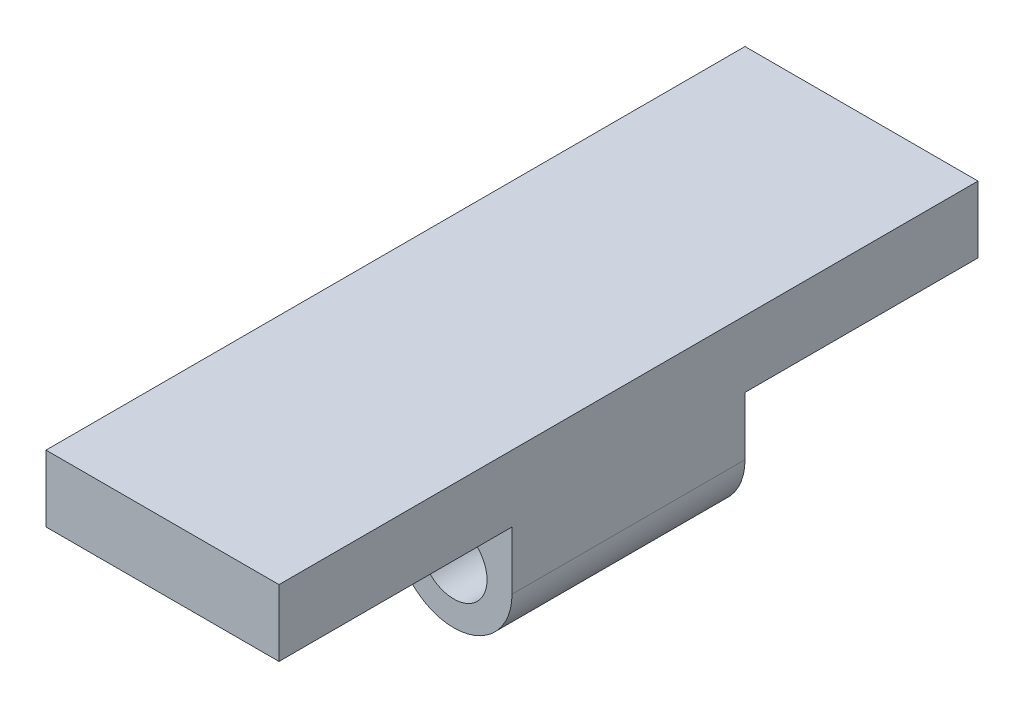
from build123d import *

# Parameters (mm, degrees)
SKETCH1_W           = 7
SKETCH1_H           = 2
BOSS_EXTRUDE1_DEPTH = 10.5
SKETCH2_R           = 1
BOSS_EXTRUDE2_DEPTH = 3.5
SKETCH3_R           = 0.975
BOSS_EXTRUDE3_DEPTH = 4.5
SWEEP1_ANGLE        = 52.758136
SWEEP1_2_OUTLINE_R  = 0.975
SWEEP1_2_ANGLE      = 51.827212
SWEEP1_START        = -1.300671735
SWEEP1_3_OUTLINE_R  = 0.975
SWEEP1_3_DEPTH      = 6.012679668
SWEEP1_4_OUTLINE_R  = 0.975
SWEEP1_4_DEPTH      = 4.014132691


with BuildPart() as part:
    # Sketch1 → Boss-Extrude1 (new, symmetric)
    with BuildSketch(Plane.XY):
        with Locations((-0.090659996, 1.000603453)):
            Rectangle(SKETCH1_W, SKETCH1_H)
    extrude(amount=BOSS_EXTRUDE1_DEPTH, both=True)

    # Sketch2 → Boss-Extrude2 (add, symmetric)
    with BuildSketch(Plane.XY):
        with BuildLine():
            Line((3.409340004, 0.000603453), (3.409340004, -1.749396547))
            ThreePointArc((3.409340004, -1.749396547), (1.659340004, -3.499396547), (-0.090659996, -1.749396547))
            Line((-0.090659996, -1.749396547), (-0.090659996, 0.000603453))
            Line((-0.090659996, 0.000603453), (3.409340004, 0.000603453))
        make_face()
        with Locations((1.659340004, -1.749396547)):
            Circle(SKETCH2_R, mode=Mode.SUBTRACT)
    extrude(amount=BOSS_EXTRUDE2_DEPTH, both=True)

    # Sweep1: read off the stored shape, not the designer's step
    # Sweep1 outline → Sweep1 (revolve)
    with BuildSketch(Plane(origin=(3.593677223, 0.783196597, 2.967256422), x_dir=(0.7080400901637386, -0.39610400747133684, 0.5846202579333633), z_dir=(0.3054408532938203, 0.9182056497676037, 0.2521988696921456))):
        with BuildLine():
            Line((0.806226014, -6.042187467), (0.806225946, -7.953288333))
            ThreePointArc((0.806225946, -7.953288333), (1.975, -6.997737942), (0.806226014, -6.042187467))
        make_face()
    sweep1 = revolve(axis=Axis((3.593677223, 0.783196597, 2.967256422), (0.6366986067678082, 0, -0.7711127570854551)), revolution_arc=SWEEP1_ANGLE)

    # Sweep1 2 outline → Sweep1 2 (revolve)
    with BuildSketch(Plane(origin=(-4.579891067, -1.470607223, 4.014132591), x_dir=(-0.5884431979545631, -0.18894965071935535, 0.7861505150249796), z_dir=(0.7485091599062733, 0.24034697795155588, 0.6180350861609393))):
        with Locations((1, -0.028291715)):
            Circle(SWEEP1_2_OUTLINE_R)
    sweep1_2 = revolve(axis=Axis((-4.579891067, -1.470607223, 4.014132591), (0.3057264141637292, -0.9521194041098986, 0)), revolution_arc=SWEEP1_2_ANGLE)

    # Sweep1 3 outline → Sweep1 3 (add)
    with BuildSketch(Plane(origin=(0, 0, 0), x_dir=(0.6631244510169609, -0.2712943464482258, -0.69761403372401), z_dir=(0.7485091599061792, 0.24034697795152507, 0.6180350861610652)).offset(SWEEP1_START)):
        with Locations((-6.338808877, -3.261453929)):
            Circle(SWEEP1_3_OUTLINE_R)
    sweep1_3 = extrude(amount=SWEEP1_3_DEPTH)

    # Sweep1 4 outline → Sweep1 4 (add)
    with BuildSketch(Plane.XY):
        with Locations((-5.540659996, -1.749396547)):
            Circle(SWEEP1_4_OUTLINE_R)
    sweep1_4 = extrude(amount=SWEEP1_4_DEPTH)

    # Mirror1: Sweep1, Sweep1 2, Sweep1 3, Sweep1 4 across plane
    add(sweep1.mirror(Plane.XY))
    add(sweep1_2.mirror(Plane.XY))
    add(sweep1_3.mirror(Plane.XY))
    add(sweep1_4.mirror(Plane.XY))


with BuildPart() as body_2:
    # Sketch3 → Boss-Extrude3 (new, symmetric)
    with BuildSketch(Plane.XY):
        with Locations((-5.540659996, -1.749396547)):
            Circle(SKETCH3_R)
    extrude(amount=BOSS_EXTRUDE3_DEPTH, both=True)


solid = Compound([part.part, body_2.part])
